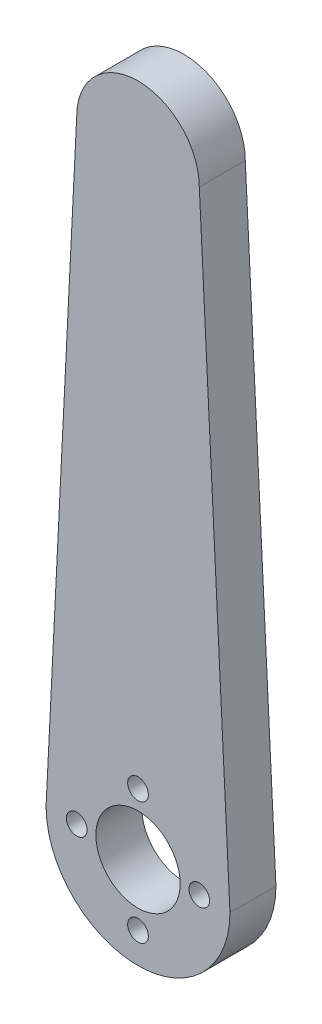
from build123d import *

# Parameters (mm, degrees)
BOSS_EXTRU_1_DEPTH           = 6
ENL_V_MAT_EXTRU_1_DEPTH      = 90.016852337
ENL_V_MAT_EXTRU_1_DEPTH_BACK = 90.016852337
ESQUISSE2_R                  = 5.5
ESQUISSE2_R_2                = 1.35


with BuildPart() as part:
    # Esquisse1 → Boss.-Extru.1 (new body)
    with BuildSketch(Plane.XY):
        with BuildLine():
            Line((12, 0), (8, 80))
            ThreePointArc((8, 80), (0, 88), (-8, 80))
            Line((-8, 80), (-12, 0))
            ThreePointArc((-12, 0), (0, -12), (12, 0))
        make_face()
    extrude(amount=BOSS_EXTRU_1_DEPTH)

    # Esquisse2 → Enlèv. mat.-Extru.1 (cut, two sides: drawn at the far end of the back side and taken through both)
    with BuildSketch(Plane.XY.offset(6).offset(-ENL_V_MAT_EXTRU_1_DEPTH_BACK)):
        Circle(ESQUISSE2_R)
        with Locations((8, 0)):
            Circle(ESQUISSE2_R_2)
        with Locations((0, -8)):
            Circle(ESQUISSE2_R_2)
        with Locations((-8, 0)):
            Circle(ESQUISSE2_R_2)
        with Locations((0, 8)):
            Circle(ESQUISSE2_R_2)
    extrude(amount=ENL_V_MAT_EXTRU_1_DEPTH + ENL_V_MAT_EXTRU_1_DEPTH_BACK, mode=Mode.SUBTRACT)


solid = part.part
